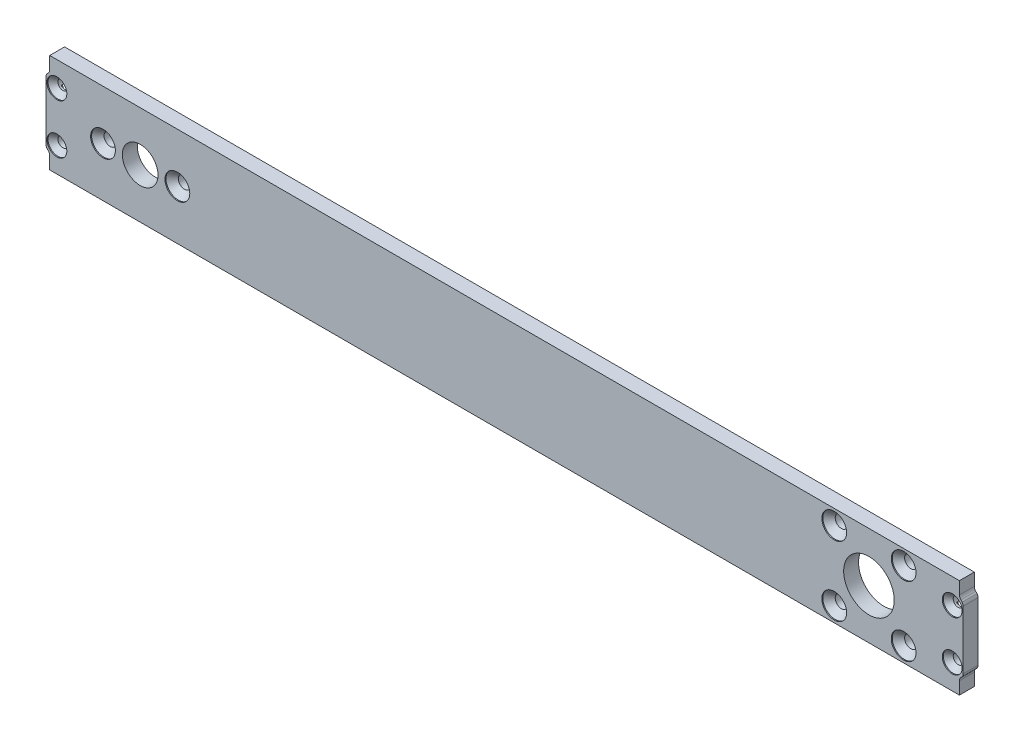
from build123d import *
from build123d.topology import SkipClean

# Parameters (mm, degrees)
SKETCH1_W                          = 185
SKETCH1_H                          = 20
BASE_SHAPE_DEPTH                   = 3
MOTOR_CUTOUTS_REACH                = 95.087
SKETCH2_R                          = 1.25
SKETCH2_R_2                        = 3.6
SKETCH2_R_3                        = 5.1
PCB_SLOT_DEPTH                     = 0.775
END_PLATE_HOLES_REACH              = 95.087
SKETCH6_R                          = 1
MOTOR_M2_5_COUNTERSUNKS_AT_2_COUNT = 2
MOTOR_M2_5_COUNTERSUNKS_AT_2_PITCH = 15
MOTOR_M2_5_COUNTERSUNKS_AT_3_COUNT = 2
MOTOR_M2_5_COUNTERSUNKS_AT_3_PITCH = 147.666008275
MOTOR_M2_5_COUNTERSUNKS_AT_4_COUNT = 2
MOTOR_M2_5_COUNTERSUNKS_AT_4_PITCH = 161.651631603
MOTOR_M2_5_COUNTERSUNKS_AT_5_COUNT = 2
MOTOR_M2_5_COUNTERSUNKS_AT_5_PITCH = 147.666008275
MOTOR_M2_5_COUNTERSUNKS_AT_6_COUNT = 2
MOTOR_M2_5_COUNTERSUNKS_AT_6_PITCH = 161.651631603
END_M2_COUNTERSUNKS_AT_2_COUNT     = 2
END_M2_COUNTERSUNKS_AT_2_PITCH     = 10
END_M2_COUNTERSUNKS_AT_3_COUNT     = 2
END_M2_COUNTERSUNKS_AT_3_PITCH     = 180.6
END_M2_COUNTERSUNKS_AT_4_COUNT     = 2
END_M2_COUNTERSUNKS_AT_4_PITCH     = 180.876643047
TAP_START                          = -1.4
TAP_SLOTS_DEPTH                    = 1.4
CUT_EXTRUDE3_REACH                 = 95.087
FILLET1_R                          = 1


with BuildPart() as part:
    # Sketch1 → Base shape (new body)
    with BuildSketch(Plane.XY):
        Rectangle(SKETCH1_W, SKETCH1_H)
    extrude(amount=-BASE_SHAPE_DEPTH)

    # Sketch2 → Motor cutouts (cut, up to next)
    with BuildSketch(Plane.XY, mode=Mode.PRIVATE) as motor_cutouts_sk1:
        with Locations((-81, 0)):
            Circle(SKETCH2_R)
    motor_cutouts_tool1 = extrude(motor_cutouts_sk1.sketch, amount=-MOTOR_CUTOUTS_REACH, mode=Mode.PRIVATE) & part.part
    # Sketch2 → Motor cutouts (cut, up to next)
    with BuildSketch(Plane.XY, mode=Mode.PRIVATE) as motor_cutouts_sk2:
        with Locations((-66, 0)):
            Circle(SKETCH2_R)
    motor_cutouts_tool2 = extrude(motor_cutouts_sk2.sketch, amount=-MOTOR_CUTOUTS_REACH, mode=Mode.PRIVATE) & part.part
    # Sketch2 → Motor cutouts (cut, up to next)
    with BuildSketch(Plane.XY, mode=Mode.PRIVATE) as motor_cutouts_sk3:
        with Locations((-73.5, 0)):
            Circle(SKETCH2_R_2)
    motor_cutouts_tool3 = extrude(motor_cutouts_sk3.sketch, amount=-MOTOR_CUTOUTS_REACH, mode=Mode.PRIVATE) & part.part
    # Sketch2 → Motor cutouts (cut, up to next)
    with BuildSketch(Plane.XY, mode=Mode.PRIVATE) as motor_cutouts_sk4:
        with Locations((73.5, 0)):
            Circle(SKETCH2_R_3)
    motor_cutouts_tool4 = extrude(motor_cutouts_sk4.sketch, amount=-MOTOR_CUTOUTS_REACH, mode=Mode.PRIVATE) & part.part
    # Sketch2 → Motor cutouts (cut, up to next)
    with BuildSketch(Plane.XY, mode=Mode.PRIVATE) as motor_cutouts_sk5:
        with Locations((66.5, 7)):
            Circle(SKETCH2_R)
    motor_cutouts_tool5 = extrude(motor_cutouts_sk5.sketch, amount=-MOTOR_CUTOUTS_REACH, mode=Mode.PRIVATE) & part.part
    # Sketch2 → Motor cutouts (cut, up to next)
    with BuildSketch(Plane.XY, mode=Mode.PRIVATE) as motor_cutouts_sk6:
        with Locations((80.5, 7)):
            Circle(SKETCH2_R)
    motor_cutouts_tool6 = extrude(motor_cutouts_sk6.sketch, amount=-MOTOR_CUTOUTS_REACH, mode=Mode.PRIVATE) & part.part
    # Sketch2 → Motor cutouts (cut, up to next)
    with BuildSketch(Plane.XY, mode=Mode.PRIVATE) as motor_cutouts_sk7:
        with Locations((80.5, -7)):
            Circle(SKETCH2_R)
    motor_cutouts_tool7 = extrude(motor_cutouts_sk7.sketch, amount=-MOTOR_CUTOUTS_REACH, mode=Mode.PRIVATE) & part.part
    # Sketch2 → Motor cutouts (cut, up to next)
    with BuildSketch(Plane.XY, mode=Mode.PRIVATE) as motor_cutouts_sk8:
        with Locations((66.5, -7)):
            Circle(SKETCH2_R)
    motor_cutouts_tool8 = extrude(motor_cutouts_sk8.sketch, amount=-MOTOR_CUTOUTS_REACH, mode=Mode.PRIVATE) & part.part
    add(motor_cutouts_tool1.solids().sort_by_distance((-81, 0, 0))[0], mode=Mode.SUBTRACT)
    add(motor_cutouts_tool2.solids().sort_by_distance((-66, 0, 0))[0], mode=Mode.SUBTRACT)
    add(motor_cutouts_tool3.solids().sort_by_distance((-73.5, 0, 0))[0], mode=Mode.SUBTRACT)
    add(motor_cutouts_tool4.solids().sort_by_distance((73.5, 0, 0))[0], mode=Mode.SUBTRACT)
    add(motor_cutouts_tool5.solids().sort_by_distance((66.5, 7, 0))[0], mode=Mode.SUBTRACT)
    add(motor_cutouts_tool6.solids().sort_by_distance((80.5, 7, 0))[0], mode=Mode.SUBTRACT)
    add(motor_cutouts_tool7.solids().sort_by_distance((80.5, -7, 0))[0], mode=Mode.SUBTRACT)
    add(motor_cutouts_tool8.solids().sort_by_distance((66.5, -7, 0))[0], mode=Mode.SUBTRACT)

    # Sketch5 → PCB slot (cut)
    with BuildSketch(Plane(origin=(0, 0, -3), x_dir=(-1, 0, 0), z_dir=(0, 0, -1))):
        with BuildLine():
            Line((-60, -6), (60, -6))
            ThreePointArc((60, -6), (61, -7), (60, -8))
            Line((60, -8), (-60, -8))
            ThreePointArc((-60, -8), (-61, -7), (-60, -6))
        make_face()
    extrude(amount=-PCB_SLOT_DEPTH, mode=Mode.SUBTRACT)

    # Sketch6 → End plate holes (cut, up to next)
    with BuildSketch(Plane.XY, mode=Mode.PRIVATE) as end_plate_holes_sk1:
        with Locations((90.3, 5)):
            Circle(SKETCH6_R)
    end_plate_holes_tool1 = extrude(end_plate_holes_sk1.sketch, amount=-END_PLATE_HOLES_REACH, mode=Mode.PRIVATE) & part.part
    # Sketch6 → End plate holes (cut, up to next)
    with BuildSketch(Plane.XY, mode=Mode.PRIVATE) as end_plate_holes_sk2:
        with Locations((90.3, -5)):
            Circle(SKETCH6_R)
    end_plate_holes_tool2 = extrude(end_plate_holes_sk2.sketch, amount=-END_PLATE_HOLES_REACH, mode=Mode.PRIVATE) & part.part
    # Sketch6 → End plate holes (cut, up to next)
    with BuildSketch(Plane.XY, mode=Mode.PRIVATE) as end_plate_holes_sk3:
        with Locations((-90.3, -5)):
            Circle(SKETCH6_R)
    end_plate_holes_tool3 = extrude(end_plate_holes_sk3.sketch, amount=-END_PLATE_HOLES_REACH, mode=Mode.PRIVATE) & part.part
    # Sketch6 → End plate holes (cut, up to next)
    with BuildSketch(Plane.XY, mode=Mode.PRIVATE) as end_plate_holes_sk4:
        with Locations((-90.3, 5)):
            Circle(SKETCH6_R)
    end_plate_holes_tool4 = extrude(end_plate_holes_sk4.sketch, amount=-END_PLATE_HOLES_REACH, mode=Mode.PRIVATE) & part.part
    add(end_plate_holes_tool1.solids().sort_by_distance((90.3, 5, 0))[0], mode=Mode.SUBTRACT)
    add(end_plate_holes_tool2.solids().sort_by_distance((90.3, -5, 0))[0], mode=Mode.SUBTRACT)
    add(end_plate_holes_tool3.solids().sort_by_distance((-90.3, -5, 0))[0], mode=Mode.SUBTRACT)
    add(end_plate_holes_tool4.solids().sort_by_distance((-90.3, 5, 0))[0], mode=Mode.SUBTRACT)

    # Sketch4 → Motor M2.5 countersunks (revolve, cut)
    with BuildSketch(Plane(origin=(-81, 0, 0), x_dir=(0, -1, 0), z_dir=(1, 0, 0))):
        Polygon((0, 0), (0, 3), (1.25, 3), (1.25, 1.45), (2.5, 0.2), (2.5, 0), align=None)
    motor_m2_5_countersunks = revolve(axis=Axis((-81, 0, 6.35), (0, 0, -1)), mode=Mode.SUBTRACT)

    # Motor M2.5 countersunks at 2: Motor M2.5 countersunks ×2
    with Locations(*[(i * MOTOR_M2_5_COUNTERSUNKS_AT_2_PITCH, 0, 0) for i in range(1, MOTOR_M2_5_COUNTERSUNKS_AT_2_COUNT)]):
        add(motor_m2_5_countersunks, mode=Mode.SUBTRACT)

    # Motor M2.5 countersunks at 3: Motor M2.5 countersunks ×2
    with Locations(*[Vector(0.9988757854473691, 0.047404274563603965, 0) * (i * MOTOR_M2_5_COUNTERSUNKS_AT_3_PITCH) for i in range(1, MOTOR_M2_5_COUNTERSUNKS_AT_3_COUNT)]):
        add(motor_m2_5_countersunks, mode=Mode.SUBTRACT)

    # Motor M2.5 countersunks at 4: Motor M2.5 countersunks ×2
    with Locations(*[Vector(0.9990619853213468, 0.043302996267798335, 0) * (i * MOTOR_M2_5_COUNTERSUNKS_AT_4_PITCH) for i in range(1, MOTOR_M2_5_COUNTERSUNKS_AT_4_COUNT)]):
        add(motor_m2_5_countersunks, mode=Mode.SUBTRACT)

    # Motor M2.5 countersunks at 5: Motor M2.5 countersunks ×2
    with Locations(*[Vector(0.9988757854473691, -0.04740427456360395, 0) * (i * MOTOR_M2_5_COUNTERSUNKS_AT_5_PITCH) for i in range(1, MOTOR_M2_5_COUNTERSUNKS_AT_5_COUNT)]):
        add(motor_m2_5_countersunks, mode=Mode.SUBTRACT)

    # Motor M2.5 countersunks at 6: Motor M2.5 countersunks ×2
    with Locations(*[Vector(0.9990619853213468, -0.0433029962677983, 0) * (i * MOTOR_M2_5_COUNTERSUNKS_AT_6_PITCH) for i in range(1, MOTOR_M2_5_COUNTERSUNKS_AT_6_COUNT)]):
        add(motor_m2_5_countersunks, mode=Mode.SUBTRACT)

    # Sketch9 → End M2 countersunks (revolve, cut)
    with BuildSketch(Plane(origin=(90.3, 5, 0), x_dir=(0, -1, 0), z_dir=(1, 0, 0))):
        Polygon((0, 0), (0, 3), (1, 3), (1, 1.2), (2, 0.2), (2, 0), align=None)
    end_m2_countersunks = revolve(axis=Axis((90.3, 5, 6.35), (0, 0, -1)), mode=Mode.SUBTRACT)

    # End M2 countersunks at 2: End M2 countersunks ×2
    with Locations(*[(0, -i * END_M2_COUNTERSUNKS_AT_2_PITCH, 0) for i in range(1, END_M2_COUNTERSUNKS_AT_2_COUNT)]):
        add(end_m2_countersunks, mode=Mode.SUBTRACT)

    # End M2 countersunks at 3: End M2 countersunks ×2
    with Locations(*[(-i * END_M2_COUNTERSUNKS_AT_3_PITCH, 0, 0) for i in range(1, END_M2_COUNTERSUNKS_AT_3_COUNT)]):
        add(end_m2_countersunks, mode=Mode.SUBTRACT)

    # End M2 countersunks at 4: End M2 countersunks ×2
    with Locations(*[Vector(-0.9984705430039356, -0.055286298062233535, 0) * (i * END_M2_COUNTERSUNKS_AT_4_PITCH) for i in range(1, END_M2_COUNTERSUNKS_AT_4_COUNT)]):
        add(end_m2_countersunks, mode=Mode.SUBTRACT)

    # Sketch12 → Tap slots (cut)
    with SkipClean():  # the faces are left unmerged after this step: merging them gives an invalid solid
        with BuildSketch(Plane(origin=(0, 0, -3), x_dir=(-1, 0, 0), z_dir=(0, 0, -1)).offset(TAP_START)):
            with BuildLine():
                Line((-91.9, 2.635786438), (-91.9, -2.635786438))
                ThreePointArc((-91.9, -2.635786438), (-92.085607903, -3.793515558), (-91.043923255, -4.33173494))
                ThreePointArc((-91.043923255, -4.33173494), (-91.048881163, -4.337295689), (-91.053797505, -4.342893219))
                Line((-91.053797505, -4.342893219), (-89.546202495, -4.342893219))
                ThreePointArc((-89.546202495, -4.342893219), (-89.551118837, -4.337295689), (-89.556076745, -4.33173494))
                ThreePointArc((-89.556076745, -4.33173494), (-88.514392097, -3.793515558), (-88.7, -2.635786438))
                Line((-88.7, -2.635786438), (-88.7, 2.635786438))
                ThreePointArc((-88.7, 2.635786438), (-88.514392097, 3.793515558), (-89.556076745, 4.33173494))
                ThreePointArc((-89.556076745, 4.33173494), (-89.551118837, 4.337295689), (-89.546202495, 4.342893219))
                Line((-89.546202495, 4.342893219), (-91.053797505, 4.342893219))
                ThreePointArc((-91.053797505, 4.342893219), (-91.048881163, 4.337295689), (-91.043923255, 4.33173494))
                ThreePointArc((-91.043923255, 4.33173494), (-92.085607903, 3.793515558), (-91.9, 2.635786438))
            make_face()
            with BuildLine():
                Line((91.9, -2.635786438), (91.9, 2.635786438))
                ThreePointArc((91.9, 2.635786438), (92.085607903, 3.793515558), (91.043923255, 4.33173494))
                ThreePointArc((91.043923255, 4.33173494), (91.048881163, 4.337295689), (91.053797505, 4.342893219))
                Line((91.053797505, 4.342893219), (89.546202495, 4.342893219))
                ThreePointArc((89.546202495, 4.342893219), (89.551118837, 4.337295689), (89.556076745, 4.33173494))
                ThreePointArc((89.556076745, 4.33173494), (88.514392097, 3.793515558), (88.7, 2.635786438))
                Line((88.7, 2.635786438), (88.7, -2.635786438))
                ThreePointArc((88.7, -2.635786438), (88.514392097, -3.793515558), (89.556076745, -4.33173494))
                ThreePointArc((89.556076745, -4.33173494), (89.551118837, -4.337295689), (89.546202495, -4.342893219))
                Line((89.546202495, -4.342893219), (91.053797505, -4.342893219))
                ThreePointArc((91.053797505, -4.342893219), (91.048881163, -4.337295689), (91.043923255, -4.33173494))
                ThreePointArc((91.043923255, -4.33173494), (92.085607903, -3.793515558), (91.9, -2.635786438))
            make_face()
        extrude(amount=TAP_SLOTS_DEPTH, mode=Mode.SUBTRACT)

    # Sketch13 → Cut-Extrude3 (cut, up to next)
    with BuildSketch(Plane.XY, mode=Mode.PRIVATE) as cut_extrude3_sk1:
        with BuildLine():
            Line((-91.75, 10), (-92.5, 10))
            Line((-92.5, 10), (-92.5, 6.187434209))
            ThreePointArc((-92.5, 6.187434209), (-92.173731748, 6.655031521), (-91.75, 7.036541185))
            Line((-91.75, 7.036541185), (-91.75, 10))
        make_face()
    cut_extrude3_tool1 = extrude(cut_extrude3_sk1.sketch, amount=-CUT_EXTRUDE3_REACH, mode=Mode.PRIVATE) & part.part
    # Sketch13 → Cut-Extrude3 (cut, up to next)
    with BuildSketch(Plane.XY, mode=Mode.PRIVATE) as cut_extrude3_sk2:
        with BuildLine():
            Line((92.5, 10), (91.75, 10))
            Line((91.75, 10), (91.75, 7.036541185))
            ThreePointArc((91.75, 7.036541185), (92.173731748, 6.655031521), (92.5, 6.187434209))
            Line((92.5, 6.187434209), (92.5, 10))
        make_face()
    cut_extrude3_tool2 = extrude(cut_extrude3_sk2.sketch, amount=-CUT_EXTRUDE3_REACH, mode=Mode.PRIVATE) & part.part
    # Sketch13 → Cut-Extrude3 (cut, up to next)
    with BuildSketch(Plane.XY, mode=Mode.PRIVATE) as cut_extrude3_sk3:
        with BuildLine():
            ThreePointArc((-91.75, -7.036541185), (-92.173731748, -6.655031521), (-92.5, -6.187434209))
            Line((-92.5, -6.187434209), (-92.5, -10))
            Line((-92.5, -10), (-91.75, -10))
            Line((-91.75, -10), (-91.75, -7.036541185))
        make_face()
    cut_extrude3_tool3 = extrude(cut_extrude3_sk3.sketch, amount=-CUT_EXTRUDE3_REACH, mode=Mode.PRIVATE) & part.part
    # Sketch13 → Cut-Extrude3 (cut, up to next)
    with BuildSketch(Plane.XY, mode=Mode.PRIVATE) as cut_extrude3_sk4:
        with BuildLine():
            ThreePointArc((92.5, -6.187434209), (92.173731748, -6.655031521), (91.75, -7.036541185))
            Line((91.75, -7.036541185), (91.75, -10))
            Line((91.75, -10), (92.5, -10))
            Line((92.5, -10), (92.5, -6.187434209))
        make_face()
    cut_extrude3_tool4 = extrude(cut_extrude3_sk4.sketch, amount=-CUT_EXTRUDE3_REACH, mode=Mode.PRIVATE) & part.part
    add(cut_extrude3_tool1.solids().sort_by_distance((-92.140588, 8.330084, 0))[0], mode=Mode.SUBTRACT)
    add(cut_extrude3_tool2.solids().sort_by_distance((92.140588, 8.330084, 0))[0], mode=Mode.SUBTRACT)
    add(cut_extrude3_tool3.solids().sort_by_distance((-92.140588, -8.330084, 0))[0], mode=Mode.SUBTRACT)
    add(cut_extrude3_tool4.solids().sort_by_distance((92.140588, -8.330084, 0))[0], mode=Mode.SUBTRACT)

    # Fillet1
    fillet1_edges = [part.edges().sort_by_distance(p)[0] for p in [
        (-91.75, -7.036541185, -1.5),
        (-92.5, -6.187434209, -1.5),
        (-92.5, 6.187434209, -1.5),
        (-91.75, 7.036541185, -1.5),
        (92.5, 6.187434209, -1.5),
        (91.75, 7.036541185, -1.5),
        (92.5, -6.187434209, -1.5),
        (91.75, -7.036541185, -1.5),
    ]]
    fillet(fillet1_edges, radius=FILLET1_R)


solid = part.part
